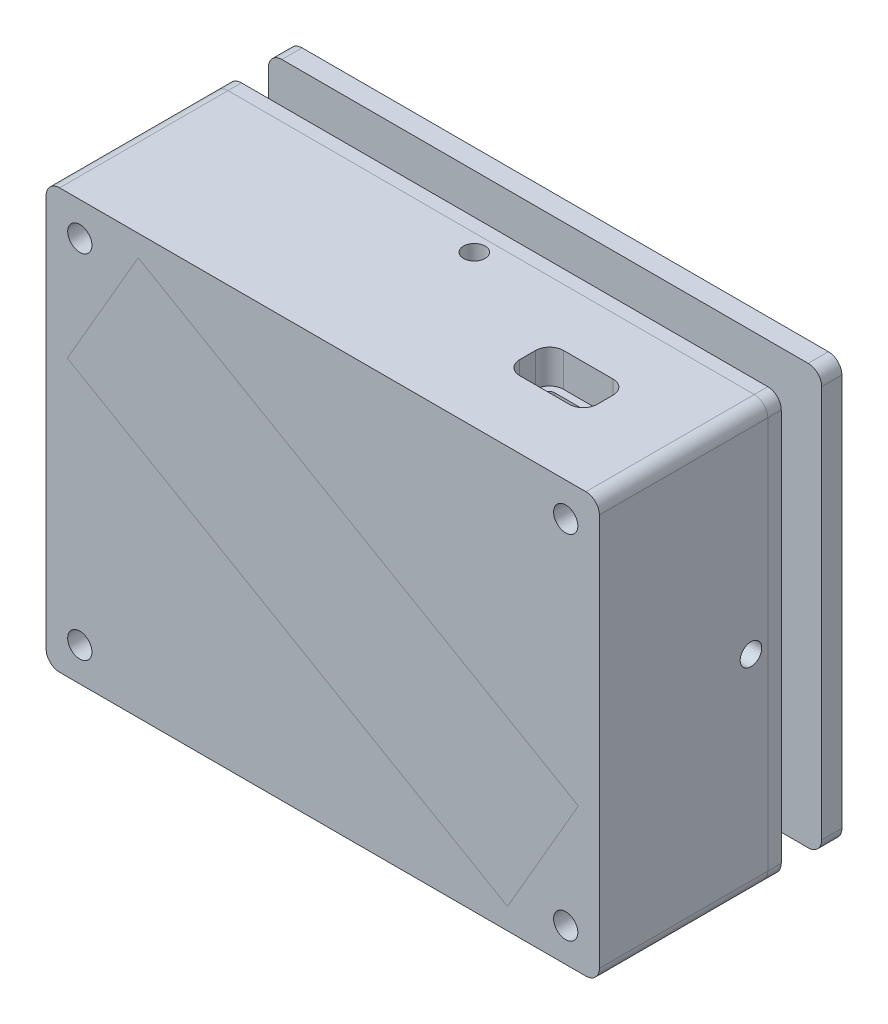
from build123d import *

# Parameters (mm, degrees)
SKETCH1_W                = 70
SKETCH1_H                = 50
BOSS_EXTRUDE1_DEPTH      = 2
BOSS_EXTRUDE2_DEPTH      = 21
EXTRUDE_THIN1_DEPTH      = 10
EXTRUDE_THIN1_DEPTH_BACK = 23
SKETCH3_W                = 82.141201594
SKETCH3_H                = 62.29
SKETCH3_W_2              = 76.141201594
SKETCH3_H_2              = 56.29
SKETCH4_W                = 76.141201594
SKETCH4_H                = 56.29
BOSS_EXTRUDE3_DEPTH      = 6
FILLET1_R                = 2
BOSS_EXTRUDE4_DEPTH      = 3
BOSS_EXTRUDE8_DEPTH      = 10
CUT_EXTRUDE1_DEPTH       = 8
CUT_EXTRUDE2_DEPTH       = 8
EXTRUDE_THIN2_DEPTH      = 6
BOSS_EXTRUDE9_START      = 2
BOSS_EXTRUDE9_DEPTH      = 1
FILLET2_R                = 3
SKETCH11_R               = 1.8
CUT_EXTRUDE3_DEPTH       = 5
CUT_EXTRUDE4_DEPTH       = 88.160559078
CUT_EXTRUDE4_DEPTH_BACK  = 88.160559078
SKETCH12_R               = 1.6
CUT_EXTRUDE5_DEPTH       = 92.040453046
CUT_EXTRUDE5_DEPTH_BACK  = 92.040453046
SKETCH13_R               = 1.6
SKETCH14_W               = 75.741201594
SKETCH14_H               = 55.89
SKETCH14_W_2             = 69.741201594
SKETCH14_H_2             = 51.09
BOSS_EXTRUDE10_DEPTH     = 6.4
CUT_EXTRUDE6_DEPTH       = 2.5
CUT_EXTRUDE7_REACH       = 86.903
SKETCH16_R               = 1.8
CUT_EXTRUDE8_REACH       = 90.164
SKETCH17_R               = 1.8
BOSS_EXTRUDE11_DEPTH     = 2
CHAMFER1_SIZE            = 3


with BuildPart() as part:
    # Sketch1 → Boss-Extrude1 (new body)
    with BuildSketch(Plane.XY):
        with Locations((-17.311659193, -1.674887892)):
            Rectangle(SKETCH1_W, SKETCH1_H)
    extrude(amount=BOSS_EXTRUDE1_DEPTH)

    # Sketch2 → Boss-Extrude2 (add)
    with BuildSketch(Plane.XY.offset(2)):
        Polygon((-42.790623702, 27.325112108), (-53.311659193, 9.150739706), (12.029536823, -28.674887892), (22.550572314, -10.500515491), align=None)
    extrude(amount=BOSS_EXTRUDE2_DEPTH)


with BuildPart() as body_2:
    # Sketch3 → Extrude-Thin1 (new, two sides: drawn at the far end of the back side and taken through both)
    with BuildSketch(Plane(origin=(0, 0, 0), x_dir=(-1, 0, 0), z_dir=(0, 0, -1)).offset(-EXTRUDE_THIN1_DEPTH_BACK)):
        with Locations((15.391058396, -0.669887892)):
            Rectangle(SKETCH3_W, SKETCH3_H)
        with Locations((15.391058396, -0.669887892)):
            Rectangle(SKETCH3_W_2, SKETCH3_H_2, mode=Mode.SUBTRACT)
    extrude(amount=EXTRUDE_THIN1_DEPTH + EXTRUDE_THIN1_DEPTH_BACK)

    # Sketch4 → Boss-Extrude3 (add)
    with BuildSketch(Plane.XY.offset(23)):
        with Locations((-15.391058396, -0.669887892)):
            Rectangle(SKETCH4_W, SKETCH4_H)
        Polygon((-42.790623702, 27.325112108), (-53.311659193, 9.150739706), (12.029536823, -28.674887892), (22.550572314, -10.500515491), align=None, mode=Mode.SUBTRACT)
    extrude(amount=-BOSS_EXTRUDE3_DEPTH)

    # Fillet1
    fillet1_edges = [body_2.edges().sort_by_distance(p)[0] for p in [
        (-56.461659193, 30.475112108, 6.5),
        (-56.461659193, -31.814887892, 6.5),
        (25.679542401, -31.814887892, 6.5),
        (25.679542401, 30.475112108, 6.5),
    ]]
    fillet(fillet1_edges, radius=FILLET1_R)

    # Sketch6 → Boss-Extrude8 (add)
    with BuildSketch(Plane(origin=(0, 0, 17), x_dir=(-1, 0, 0), z_dir=(0, 0, -1))):
        Polygon((-16.679542401, 27.475112108), (-22.679542401, 22.532519231), (-22.679542401, 27.475112108), align=None)
        Polygon((42.790623702, 27.325112108), (53.311659193, 9.150739706), (53.461659193, 27.475112108), (42.790623702, 27.475112108), align=None)
        Polygon((-12.029536823, -28.674887892), (-22.550572314, -10.500515491), (-22.679542401, -10.500515491), (-22.679542401, -28.814887892), (53.461659193, -28.814887892), (53.461659193, -25.814887892), (-7.089081569, -25.814887892), align=None)
    extrude(amount=BOSS_EXTRUDE8_DEPTH)

    # Sketch7 → Cut-Extrude1 (cut)
    with BuildSketch(Plane(origin=(0, 0, -10), x_dir=(-1, 0, 0), z_dir=(0, 0, -1))):
        Polygon((-28.614884021, 33.287753378), (-28.614884021, -37.390774311), (75.821884566, -37.390774311), (71.624058107, 45.166479381), align=None)
    extrude(amount=-CUT_EXTRUDE1_DEPTH, mode=Mode.SUBTRACT)

    # Sketch8 → Cut-Extrude2 (cut)
    with BuildSketch(Plane(origin=(0, 30.475112108, 0), x_dir=(1, 0, 0), z_dir=(0, 1, 0))):
        with BuildLine():
            Line((1.779542401, -8.574068331), (1.779542401, -10.925931669))
            ThreePointArc((1.779542401, -10.925931669), (2.38702295, -12.392519451), (3.853610732, -13))
            Line((3.853610732, -13), (11.20547407, -13))
            ThreePointArc((11.20547407, -13), (12.672061852, -12.392519451), (13.279542401, -10.925931669))
            Line((13.279542401, -10.925931669), (13.279542401, -8.574068331))
            ThreePointArc((13.279542401, -8.574068331), (12.672061852, -7.107480549), (11.20547407, -6.5))
            Line((11.20547407, -6.5), (3.853610732, -6.5))
            ThreePointArc((3.853610732, -6.5), (2.38702295, -7.107480549), (1.779542401, -8.574068331))
        make_face()
    extrude(amount=-CUT_EXTRUDE2_DEPTH, mode=Mode.SUBTRACT)

    # Sketch8<2> → Extrude-Thin2 (add)
    with BuildSketch(Plane(origin=(0, 30.475112108, 0), x_dir=(1, 0, 0), z_dir=(0, 1, 0))):
        with BuildLine():
            Line((-0.220457599, -8.574068331), (-0.220457599, -10.925931669))
            ThreePointArc((-0.220457599, -10.925931669), (0.972809388, -13.806733013), (3.853610732, -15))
            Line((3.853610732, -15), (11.20547407, -15))
            ThreePointArc((11.20547407, -15), (14.086275414, -13.806733013), (15.279542401, -10.925931669))
            Line((15.279542401, -10.925931669), (15.279542401, -8.574068331))
            ThreePointArc((15.279542401, -8.574068331), (14.086275414, -5.693266987), (11.20547407, -4.5))
            Line((11.20547407, -4.5), (3.853610732, -4.5))
            ThreePointArc((3.853610732, -4.5), (0.972809388, -5.693266987), (-0.220457599, -8.574068331))
        make_face()
        with BuildLine():
            Line((1.779542401, -8.574068331), (1.779542401, -10.925931669))
            ThreePointArc((1.779542401, -10.925931669), (2.38702295, -12.392519451), (3.853610732, -13))
            Line((3.853610732, -13), (11.20547407, -13))
            ThreePointArc((11.20547407, -13), (12.672061852, -12.392519451), (13.279542401, -10.925931669))
            Line((13.279542401, -10.925931669), (13.279542401, -8.574068331))
            ThreePointArc((13.279542401, -8.574068331), (12.672061852, -7.107480549), (11.20547407, -6.5))
            Line((11.20547407, -6.5), (3.853610732, -6.5))
            ThreePointArc((3.853610732, -6.5), (2.38702295, -7.107480549), (1.779542401, -8.574068331))
        make_face(mode=Mode.SUBTRACT)
    extrude(amount=-EXTRUDE_THIN2_DEPTH)

    # Sketch10 → Boss-Extrude9 (add)
    with BuildSketch(Plane.XZ.offset(-27.475112108).offset(BOSS_EXTRUDE9_START)):
        with BuildLine():
            Line((1.779542401, 8.574068331), (1.779542401, 10.925931669))
            ThreePointArc((1.779542401, 10.925931669), (2.38702295, 12.392519451), (3.853610732, 13))
            Line((3.853610732, 13), (11.20547407, 13))
            ThreePointArc((11.20547407, 13), (12.672061852, 12.392519451), (13.279542401, 10.925931669))
            Line((13.279542401, 10.925931669), (13.279542401, 8.574068331))
            ThreePointArc((13.279542401, 8.574068331), (12.672061852, 7.107480549), (11.20547407, 6.5))
            Line((11.20547407, 6.5), (3.853610732, 6.5))
            ThreePointArc((3.853610732, 6.5), (2.38702295, 7.107480549), (1.779542401, 8.574068331))
        make_face()
        with BuildLine():
            Line((3.679542401, 11.9), (11.379542401, 11.9))
            ThreePointArc((11.379542401, 11.9), (12.086649182, 11.607106781), (12.379542401, 10.9))
            Line((12.379542401, 10.9), (12.379542401, 8.6))
            ThreePointArc((12.379542401, 8.6), (12.086649182, 7.892893219), (11.379542401, 7.6))
            Line((11.379542401, 7.6), (3.679542401, 7.6))
            ThreePointArc((3.679542401, 7.6), (2.97243562, 7.892893219), (2.679542401, 8.6))
            Line((2.679542401, 8.6), (2.679542401, 10.9))
            ThreePointArc((2.679542401, 10.9), (2.97243562, 11.607106781), (3.679542401, 11.9))
        make_face(mode=Mode.SUBTRACT)
    extrude(amount=BOSS_EXTRUDE9_DEPTH)

    # Fillet2
    # the kernel refuses this fillet: 3 mm, written as the material it takes off along each edge
    with BuildSketch(Plane(origin=(3.853610732, 24.475112108, 15), x_dir=(0, 1, 0), z_dir=(1, 0, 0)), Plane(origin=(11.20547407, 24.475112108, 4.5), x_dir=(0, 1, 0), z_dir=(-1, 0, 0))) as fillet2_piece_1:
        with BuildLine():
            CenterArc((FILLET2_R, -FILLET2_R), FILLET2_R, 90, 90)
            Line((0, -FILLET2_R), (0, 0))
            Line((0, 0), (FILLET2_R, 0))
        make_face()
    extrude(amount=7.351863339, mode=Mode.SUBTRACT)
    with BuildSketch(Plane(origin=(11.20547407, 24.475112108, 10.925931669), x_dir=(0, 0, 1), z_dir=(-1, 0, 0))) as fillet2_piece_2:
        with BuildLine():
            CenterArc((4.074068331 - FILLET2_R, FILLET2_R), FILLET2_R, 270, 90)
            Line((4.074068331 - FILLET2_R, 0), (4.074068331, 0))
            Line((4.074068331, 0), (4.074068331, FILLET2_R))
        make_face()
    revolve(axis=Axis((11.20547407, 24.475112108, 10.925931669), (0, 1, 0)), revolution_arc=90, mode=Mode.SUBTRACT)
    with BuildSketch(Plane(origin=(11.20547407, 24.475112108, 8.574068331), x_dir=(1, 0, 0), z_dir=(0, 0, 1))) as fillet2_piece_3:
        with BuildLine():
            CenterArc((4.074068331 - FILLET2_R, FILLET2_R), FILLET2_R, 270, 90)
            Line((4.074068331 - FILLET2_R, 0), (4.074068331, 0))
            Line((4.074068331, 0), (4.074068331, FILLET2_R))
        make_face()
    revolve(axis=Axis((11.20547407, 24.475112108, 8.574068331), (0, 1, 0)), revolution_arc=90, mode=Mode.SUBTRACT)
    with BuildSketch(Plane(origin=(3.853610732, 24.475112108, 8.574068331), x_dir=(0, 0, -1), z_dir=(1, 0, 0))) as fillet2_piece_4:
        with BuildLine():
            CenterArc((4.074068331 - FILLET2_R, FILLET2_R), FILLET2_R, 270, 90)
            Line((4.074068331 - FILLET2_R, 0), (4.074068331, 0))
            Line((4.074068331, 0), (4.074068331, FILLET2_R))
        make_face()
    revolve(axis=Axis((3.853610732, 24.475112108, 8.574068331), (0, 1, 0)), revolution_arc=90, mode=Mode.SUBTRACT)
    with BuildSketch(Plane(origin=(3.853610732, 24.475112108, 10.925931669), x_dir=(-1, 0, 0), z_dir=(0, 0, -1))) as fillet2_piece_5:
        with BuildLine():
            CenterArc((4.074068331 - FILLET2_R, FILLET2_R), FILLET2_R, 270, 90)
            Line((4.074068331 - FILLET2_R, 0), (4.074068331, 0))
            Line((4.074068331, 0), (4.074068331, FILLET2_R))
        make_face()
    revolve(axis=Axis((3.853610732, 24.475112108, 10.925931669), (0, 1, 0)), revolution_arc=90, mode=Mode.SUBTRACT)
    with BuildSketch(Plane(origin=(-0.220457599, 24.475112108, 8.574068331), x_dir=(0, 1, 0), z_dir=(0, 0, 1)), Plane(origin=(15.279542401, 24.475112108, 10.925931669), x_dir=(0, 1, 0), z_dir=(0, 0, -1))) as fillet2_piece_6:
        with BuildLine():
            CenterArc((FILLET2_R, -FILLET2_R), FILLET2_R, 90, 90)
            Line((0, -FILLET2_R), (0, 0))
            Line((0, 0), (FILLET2_R, 0))
        make_face()
    extrude(amount=2.351863339, mode=Mode.SUBTRACT)

    # Sketch11 → Cut-Extrude3 (cut)
    with BuildSketch(Plane.XY.offset(23)):
        with Locations((-51.461659193, 25.475112108)):
            Circle(SKETCH11_R)
        with Locations(Location((-51.461659193, -26.814887892, 0), (0, 0, 180))):
            Circle(SKETCH11_R)
        with Locations((20.679542401, -26.814887892)):
            Circle(SKETCH11_R)
        with Locations(Location((20.679542401, 25.475112108, 0), (0, 0, 180))):
            Circle(SKETCH11_R)
    extrude(amount=-CUT_EXTRUDE3_DEPTH, mode=Mode.SUBTRACT)

    # Sketch12 → Cut-Extrude4 (cut, two sides: drawn at the far end of the back side and taken through both)
    with BuildSketch(Plane(origin=(0, 30.475112108, 0), x_dir=(1, 0, 0), z_dir=(0, 1, 0)).offset(-CUT_EXTRUDE4_DEPTH_BACK)):
        with Locations(Location((-15.391058396, -0.5, 0), (0, 0, 180))):
            Circle(SKETCH12_R)
    extrude(amount=CUT_EXTRUDE4_DEPTH + CUT_EXTRUDE4_DEPTH_BACK, mode=Mode.SUBTRACT)

    # Sketch13 → Cut-Extrude5 (cut, two sides: drawn at the far end of the back side and taken through both)
    with BuildSketch(Plane(origin=(25.679542401, 0, 0), x_dir=(0, 0, -1), z_dir=(1, 0, 0)).offset(-CUT_EXTRUDE5_DEPTH_BACK)):
        with Locations(Location((-0.5, -0.669887892, 0), (0, 0, 90))):
            Circle(SKETCH13_R)
    extrude(amount=CUT_EXTRUDE5_DEPTH + CUT_EXTRUDE5_DEPTH_BACK, mode=Mode.SUBTRACT)


with BuildPart() as body_3:
    # Sketch5 → Boss-Extrude4 (new body)
    with BuildSketch(Plane(origin=(0, 0, -10), x_dir=(-1, 0, 0), z_dir=(0, 0, -1))):
        with BuildLine():
            Line((-25.679542401, 28.475112108), (-25.679542401, -29.814887892))
            ThreePointArc((-25.679542401, -29.814887892), (-25.093755963, -31.229101455), (-23.679542401, -31.814887892))
            Line((-23.679542401, -31.814887892), (54.461659193, -31.814887892))
            ThreePointArc((54.461659193, -31.814887892), (55.875872755, -31.229101455), (56.461659193, -29.814887892))
            Line((56.461659193, -29.814887892), (56.461659193, 28.475112108))
            ThreePointArc((56.461659193, 28.475112108), (55.875872755, 29.88932567), (54.461659193, 30.475112108))
            Line((54.461659193, 30.475112108), (-23.679542401, 30.475112108))
            ThreePointArc((-23.679542401, 30.475112108), (-25.093755963, 29.88932567), (-25.679542401, 28.475112108))
        make_face()
    extrude(amount=BOSS_EXTRUDE4_DEPTH)


with BuildPart() as body_4:
    # Sketch14 → Boss-Extrude10 (new body)
    with BuildSketch(Plane(origin=(0, 0, -2), x_dir=(-1, 0, 0), z_dir=(0, 0, -1))):
        with Locations((15.391058396, -0.669887892)):
            Rectangle(SKETCH14_W, SKETCH14_H)
        with Locations((15.391058396, -0.069887892)):
            Rectangle(SKETCH14_W_2, SKETCH14_H_2, mode=Mode.SUBTRACT)
    extrude(amount=-BOSS_EXTRUDE10_DEPTH)

    # Sketch15 → Cut-Extrude6 (cut)
    with BuildSketch(Plane.XY.offset(4.4)):
        Polygon((-53.261659193, -28.614887892), (-53.261659193, -3.614887892), (-50.261659193, -3.614887892), (-50.261659193, -25.614887892), (-28.261659193, -25.614887892), (-28.261659193, -28.614887892), align=None)
    extrude(amount=-CUT_EXTRUDE6_DEPTH, mode=Mode.SUBTRACT)

    # Cut-Extrude7: up to this face of the body (flat: up to its plane)
    cut_extrude7_end = Plane(body_4.part.faces().sort_by_distance((-15.391058396, 27.275112108, 1.2))[0])
    # Sketch16 → Cut-Extrude7 (cut, up to the picked face)
    with BuildSketch(Plane.XZ.offset(28.614887892), mode=Mode.PRIVATE) as cut_extrude7_sk1:
        with Locations(Location((-15.395888717, 0.521143734, 0), (0, 0, 270))):
            Circle(SKETCH16_R)
    cut_extrude7_tool1 = split(extrude(cut_extrude7_sk1.sketch, amount=-CUT_EXTRUDE7_REACH, mode=Mode.PRIVATE), bisect_by=cut_extrude7_end, keep=Keep.BOTH, mode=Mode.PRIVATE)
    add(cut_extrude7_tool1.solids().sort_by(Axis((-15.395889, -28.614888, 0.521144), (0, 1, 0)))[0], mode=Mode.SUBTRACT)

    # Cut-Extrude8: up to this face of the body (flat: up to its plane)
    cut_extrude8_end = Plane(body_4.part.faces().sort_by_distance((-53.261659193, 2.600185212, 0.787138715))[0])
    # Sketch17 → Cut-Extrude8 (cut, up to the picked face)
    with BuildSketch(Plane(origin=(22.479542401, 0, 0), x_dir=(0, 0, -1), z_dir=(1, 0, 0)), mode=Mode.PRIVATE) as cut_extrude8_sk1:
        with Locations(Location((-0.5, -0.669887892, 0), (0, 0, 90))):
            Circle(SKETCH17_R)
    cut_extrude8_tool1 = split(extrude(cut_extrude8_sk1.sketch, amount=-CUT_EXTRUDE8_REACH, mode=Mode.PRIVATE), bisect_by=cut_extrude8_end, keep=Keep.BOTH, mode=Mode.PRIVATE)
    add(cut_extrude8_tool1.solids().sort_by(Axis((22.479542, -0.669888, 0.5), (-1, 0, 0)))[0], mode=Mode.SUBTRACT)

    # Chamfer1
    # the kernel refuses this chamfer: 3 mm, written as the material it takes off along each edge
    with BuildSketch(Plane(origin=(-28.261659193, -17.899838928, 4.4), x_dir=(0.9996219169112968, 0, 0.02749587661058648), z_dir=(0, -1, 0))) as chamfer1_piece_1_section:
        Polygon((CHAMFER1_SIZE * 0.999621916911, -CHAMFER1_SIZE * 0.0274958766106), (-CHAMFER1_SIZE * 0.0274958766106, -CHAMFER1_SIZE * 0.999621916911), (0, 0), align=None)
    chamfer1_piece_1 = extrude(amount=18.430097928, mode=Mode.PRIVATE)
    chamfer1_piece_1 = split(chamfer1_piece_1, bisect_by=Plane(origin=(-27.235579619, -27.114887892, 1.9), z_dir=(0, 0, 1)), keep=Keep.TOP, mode=Mode.PRIVATE)
    add(chamfer1_piece_1, mode=Mode.SUBTRACT)
    with BuildSketch(Plane(origin=(-60.976708157, -3.614887892, 4.4), x_dir=(0, 0.9996219169112968, 0.02749587661058649), z_dir=(1, 0, 0))) as chamfer1_piece_2_section:
        Polygon((CHAMFER1_SIZE * 0.999621916911, -CHAMFER1_SIZE * 0.0274958766106), (-CHAMFER1_SIZE * 0.0274958766106, -CHAMFER1_SIZE * 0.999621916911), (0, 0), align=None)
    chamfer1_piece_2 = extrude(amount=18.430097928, mode=Mode.PRIVATE)
    chamfer1_piece_2 = split(chamfer1_piece_2, bisect_by=Plane(origin=(-51.761659193, -2.588808319, 1.9), z_dir=(0, 0, 1)), keep=Keep.TOP, mode=Mode.PRIVATE)
    add(chamfer1_piece_2, mode=Mode.SUBTRACT)


with BuildPart() as body_5:
    # Sketch18 → Boss-Extrude11 (new body)
    with BuildSketch(Plane(origin=(0, 0, -2), x_dir=(-1, 0, 0), z_dir=(0, 0, -1))):
        with BuildLine():
            Line((54.461659193, 30.475112108), (-23.679542401, 30.475112108))
            ThreePointArc((-23.679542401, 30.475112108), (-25.093755963, 29.88932567), (-25.679542401, 28.475112108))
            Line((-25.679542401, 28.475112108), (-25.679542401, -29.814887892))
            ThreePointArc((-25.679542401, -29.814887892), (-25.093755963, -31.229101455), (-23.679542401, -31.814887892))
            Line((-23.679542401, -31.814887892), (54.461659193, -31.814887892))
            ThreePointArc((54.461659193, -31.814887892), (55.875872755, -31.229101455), (56.461659193, -29.814887892))
            Line((56.461659193, -29.814887892), (56.461659193, 28.475112108))
            ThreePointArc((56.461659193, 28.475112108), (55.875872755, 29.88932567), (54.461659193, 30.475112108))
        make_face()
    extrude(amount=BOSS_EXTRUDE11_DEPTH)


solid = Compound([part.part, body_2.part, body_3.part, body_4.part, body_5.part])
